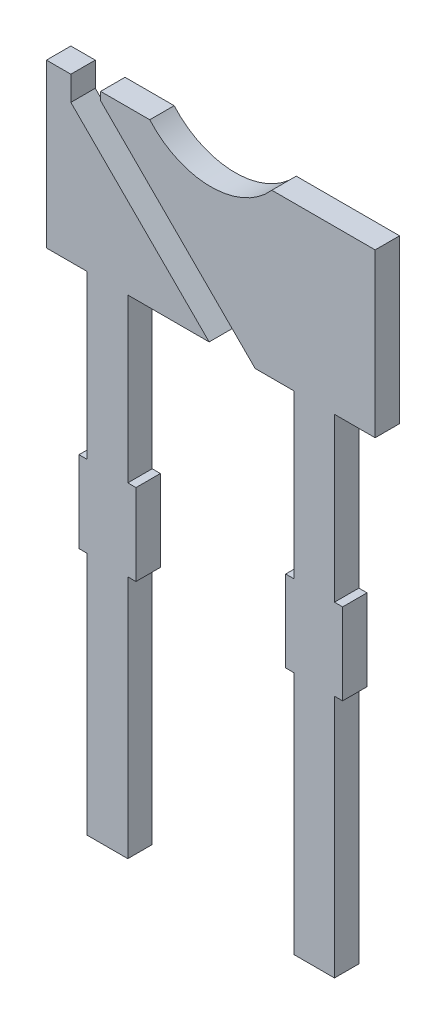
from build123d import *

# Parameters (mm, degrees)
BOSS_EXTRUDE1_DEPTH   = 0.15
BOSS_EXTRUDE1_2_DEPTH = 0.15
CUT_EXTRUDE1_DEPTH    = 7.878550525


with BuildPart() as part:
    # Sketch1 → Boss-Extrude1 (new, symmetric)
    with BuildSketch(Plane.XY):
        Polygon((1.02, 1.568413607), (1.02, -1.431586393), (1.52, -1.431586393), (1.52, 1.568413607), (1.62, 1.568413607), (1.62, 2.568413607), (1.52, 2.568413607), (1.52, 4.568413607), (2.02, 4.568413607), (2.02, 6.568413607), (-1.354314575, 6.568413607), (-1.354314575, 6.468413607), (0.545685425, 4.568413607), (1.02, 4.568413607), (1.02, 2.568413607), (0.92, 2.568413607), (0.92, 1.568413607), align=None)
    extrude(amount=BOSS_EXTRUDE1_DEPTH, both=True)

    # Sketch2 → Cut-Extrude1 (cut, through all)
    with BuildSketch(Plane.XY.offset(0.15)):
        with BuildLine():
            Line((-0.75, 6.568413607), (0.75, 6.568413607))
            ThreePointArc((0.75, 6.568413607), (0, 6.229851435), (-0.75, 6.568413607))
        make_face()
    extrude(amount=-CUT_EXTRUDE1_DEPTH, mode=Mode.SUBTRACT)


with BuildPart() as body_2:
    # Sketch1 → Boss-Extrude1 2 (new, symmetric)
    with BuildSketch(Plane.XY):
        Polygon((-1.52, 1.568413607), (-1.62, 1.568413607), (-1.62, 2.568413607), (-1.52, 2.568413607), (-1.52, 4.568413607), (-2.02, 4.568413607), (-2.02, 6.568413607), (-1.72, 6.568413607), (-1.72, 6.268413607), (-0.02, 4.568413607), (-1.02, 4.568413607), (-1.02, 2.568413607), (-0.92, 2.568413607), (-0.92, 1.568413607), (-1.02, 1.568413607), (-1.02, -1.431586393), (-1.52, -1.431586393), align=None)
    extrude(amount=BOSS_EXTRUDE1_2_DEPTH, both=True)


solid = Compound([part.part, body_2.part])
